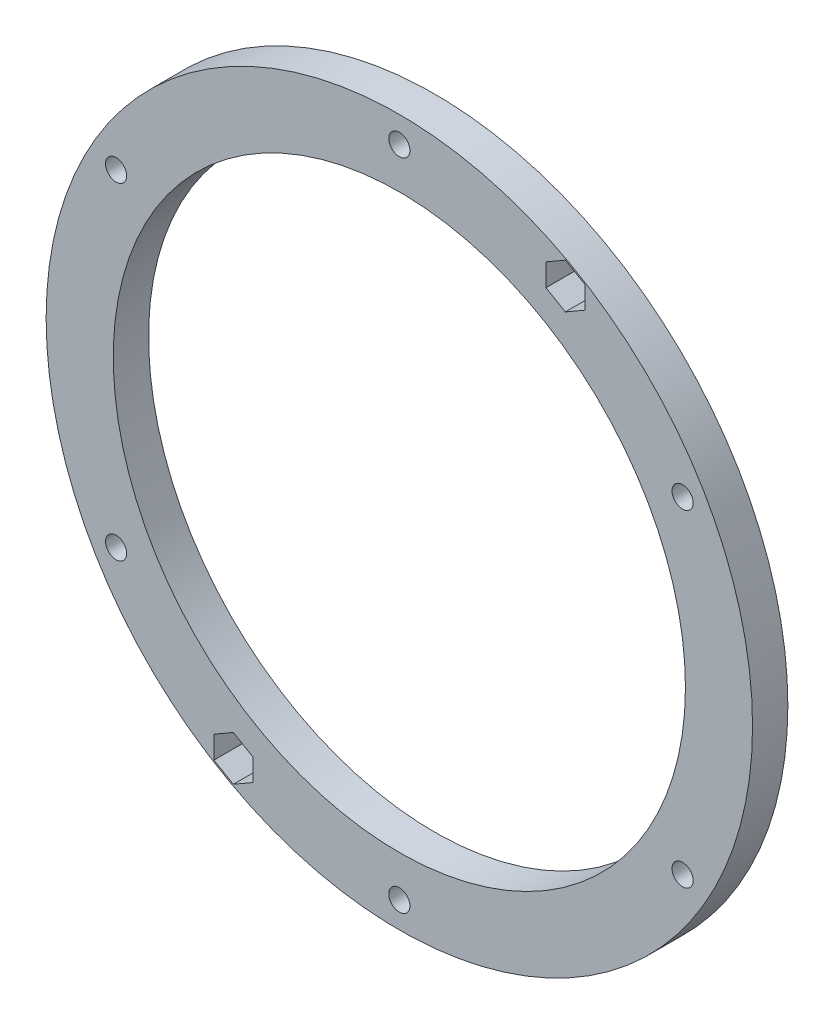
from build123d import *

# Parameters (mm, degrees)
ESQUISSE1_R        = 50
ESQUISSE1_R_2      = 1.5
BOSS_EXTRU_1_DEPTH = 5
CUT_EXTRUDE4_DEPTH = 10
SKETCH5_R          = 40.5
CUT_EXTRUDE5_DEPTH = 10


with BuildPart() as part:
    # Esquisse1 → Boss.-Extru.1 (new body)
    with BuildSketch(Plane.XY):
        Circle(ESQUISSE1_R)
        with Locations((0, 46.3)):
            Circle(ESQUISSE1_R_2, mode=Mode.SUBTRACT)
        with Locations((40.096976195, 23.15)):
            Circle(ESQUISSE1_R_2, mode=Mode.SUBTRACT)
        with Locations((40.096976195, -23.15)):
            Circle(ESQUISSE1_R_2, mode=Mode.SUBTRACT)
        with Locations((0, -46.3)):
            Circle(ESQUISSE1_R_2, mode=Mode.SUBTRACT)
        with Locations((-40.096976195, -23.15)):
            Circle(ESQUISSE1_R_2, mode=Mode.SUBTRACT)
        with Locations((-40.096976195, 23.15)):
            Circle(ESQUISSE1_R_2, mode=Mode.SUBTRACT)
    extrude(amount=BOSS_EXTRU_1_DEPTH)

    # Sketch4 → Cut-Extrude4 (cut)
    with BuildSketch(Plane.XY.offset(5)):
        Polygon((-20.75, -39.115480738), (-23.5, -37.527767497), (-26.25, -39.115480738), (-26.25, -42.290907218), (-23.5, -43.878620458), (-20.75, -42.290907218), align=None)
        Polygon((26.25, 42.290907218), (23.5, 43.878620458), (20.75, 42.290907218), (20.75, 39.115480738), (23.5, 37.527767497), (26.25, 39.115480738), align=None)
    extrude(amount=-CUT_EXTRUDE4_DEPTH, mode=Mode.SUBTRACT)

    # Sketch5 → Cut-Extrude5 (cut)
    with BuildSketch(Plane.XY.offset(5)):
        Circle(SKETCH5_R)
    extrude(amount=-CUT_EXTRUDE5_DEPTH, mode=Mode.SUBTRACT)


solid = part.part
